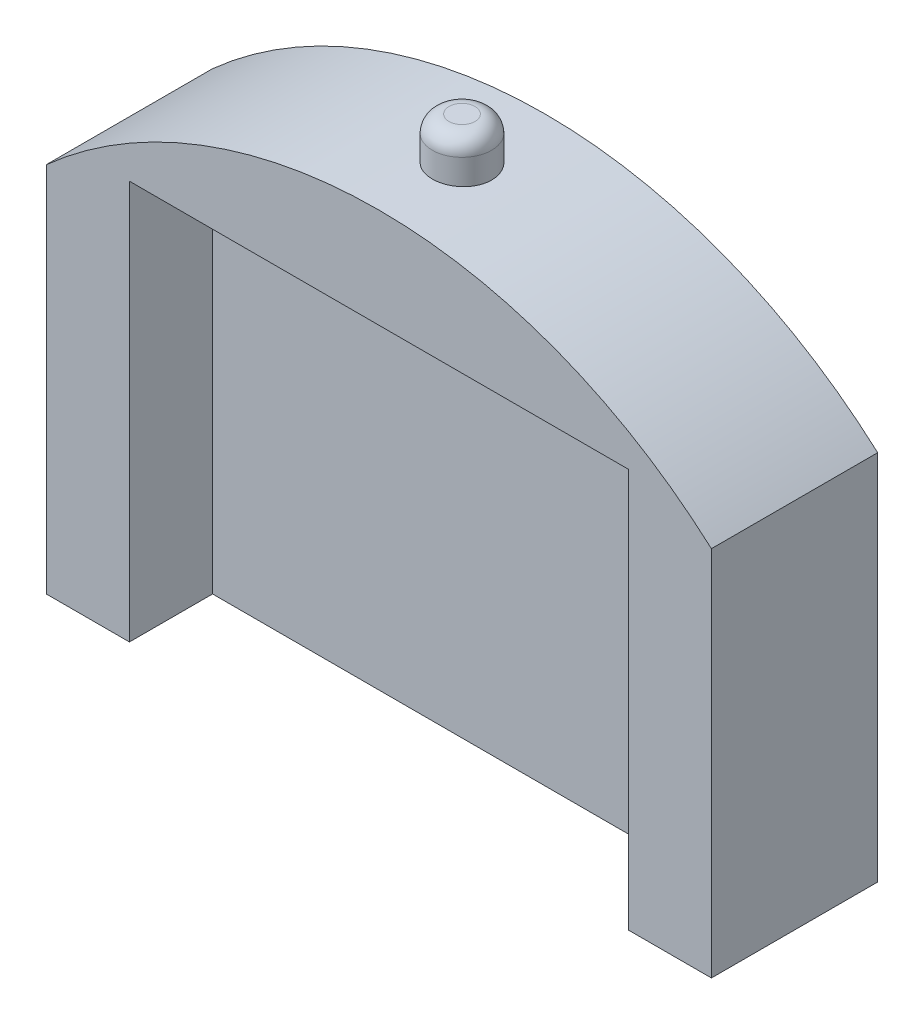
from build123d import *

# Parameters (mm, degrees)
SKETCH2_W           = 40
SKETCH2_H           = 10
BOSS_EXTRUDE1_DEPTH = 40
CUT_EXTRUDE1_START  = -10
CUT_EXTRUDE1_DEPTH  = 10
SKETCH7_R           = 1.782070526
BOSS_EXTRUDE2_DEPTH = 32.5
FILLET2_R           = 1
SKETCH8_W           = 30
SKETCH8_H           = 24
CUT_EXTRUDE2_DEPTH  = 5


# Read off the part's stored shape, not the designer's step: Cut-Extrude1
with BuildPart() as part:
    # Sketch2 → Boss-Extrude1 (new body)
    with BuildSketch(Plane(origin=(0, 0, 0), x_dir=(1, 0, 0), z_dir=(0, 1, 0))):
        Rectangle(SKETCH2_W, SKETCH2_H)
    extrude(amount=BOSS_EXTRUDE1_DEPTH)

    # Cut-Extrude1 outline → Cut-Extrude1 (cut)
    with BuildSketch(Plane(origin=(0, 0, -5), x_dir=(-1, 0, 0), z_dir=(0, 0, -1)).offset(CUT_EXTRUDE1_START)):
        with BuildLine():
            ThreePointArc((-20, 22.360679775), (0, 30), (20, 22.360679775))
            Line((20, 22.360679775), (20, 40))
            Line((20, 40), (-20, 40))
            Line((-20, 40), (-20, 22.360679775))
        make_face()
    extrude(amount=CUT_EXTRUDE1_DEPTH, mode=Mode.SUBTRACT)

    # Sketch7 → Boss-Extrude2 (add)
    with BuildSketch(Plane(origin=(0, 0, 0), x_dir=(1, 0, 0), z_dir=(0, 1, 0))):
        with Locations(Location((0, 0, 0), (0, 0, 90))):
            Circle(SKETCH7_R)
    extrude(amount=BOSS_EXTRUDE2_DEPTH)

    # Fillet2
    fillet2_edges = [part.edges().sort_by_distance(p)[0] for p in [
        (0, 32.5, 1.782070526),
    ]]
    fillet(fillet2_edges, radius=FILLET2_R)

    # Sketch8 → Cut-Extrude2 (cut)
    with BuildSketch(Plane.XY):
        with Locations((0, 12)):
            Rectangle(SKETCH8_W, SKETCH8_H)
    extrude(amount=CUT_EXTRUDE2_DEPTH, mode=Mode.SUBTRACT)


solid = part.part
